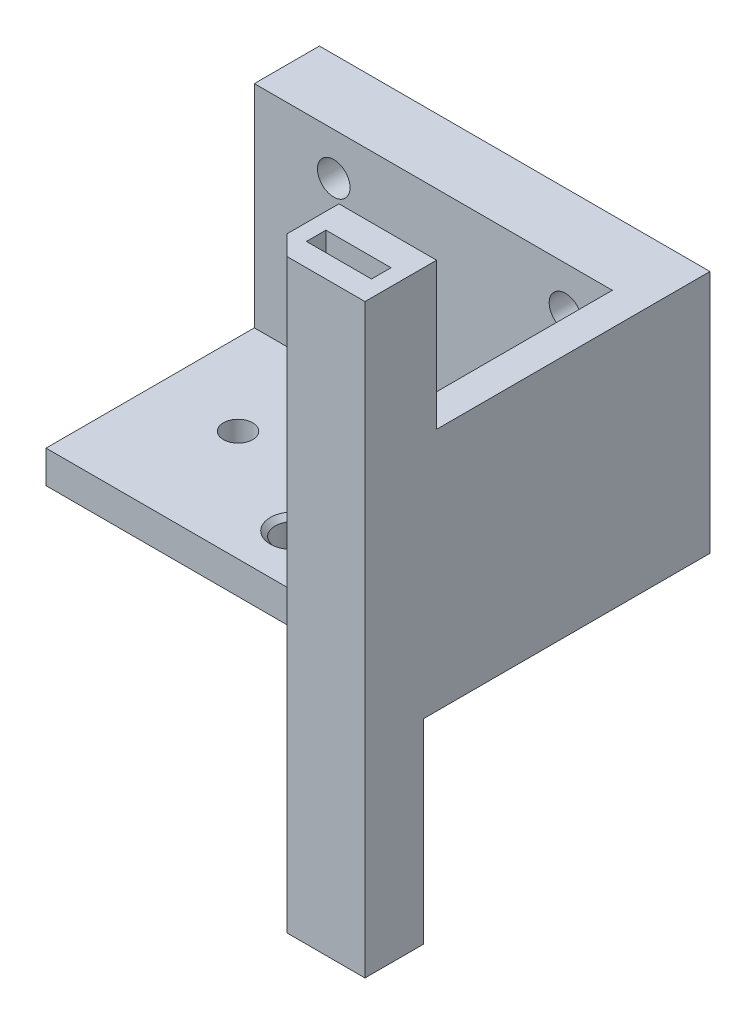
from build123d import *

# Parameters (mm, degrees)
SKETCH1_R                = 2.8
SKETCH1_R_2              = 2.25
BOSS_EXTRUDE1_DEPTH      = 5
SKETCH3_W                = 60
SKETCH3_H                = 10
BOSS_EXTRUDE3_DEPTH      = 32.5
SKETCH4_R                = 2.5
CUT_EXTRUDE1_DEPTH       = 64.798510954
CHAMFER1_SIZE            = 0.75
BOSS_EXTRUDE4_DEPTH      = 30
BOSS_EXTRUDE4_DEPTH_BACK = 60
SKETCH5_W                = 10
SKETCH5_H                = 3
CHAMFER2_SIZE            = 10
CHAMFER3_SIZE            = 5
SKETCH7_W                = 2
SKETCH7_H                = 30
CUT_EXTRUDE2_DEPTH       = 94.808315196
BOSS_EXTRUDE5_DEPTH      = 5


with BuildPart() as part:
    # Sketch1 → Boss-Extrude1 (new body)
    with BuildSketch(Plane(origin=(0, 0, 0), x_dir=(1, 0, 0), z_dir=(0, 1, 0))):
        Polygon((-30, 0), (-30, 40), (30, 40), (30, 0), (30, -2), (-30, -2), align=None)
        with Locations((-12.5, 22.5)):
            Circle(SKETCH1_R, mode=Mode.SUBTRACT)
        with Locations((12.5, 22.5)):
            Circle(SKETCH1_R, mode=Mode.SUBTRACT)
        with Locations((-17.5, 15)):
            Circle(SKETCH1_R_2, mode=Mode.SUBTRACT)
        with Locations((17.5, 15)):
            Circle(SKETCH1_R_2, mode=Mode.SUBTRACT)
        with Locations((0, 6)):
            Circle(SKETCH1_R, mode=Mode.SUBTRACT)
    extrude(amount=BOSS_EXTRUDE1_DEPTH)

    # Sketch3 → Boss-Extrude3 (add)
    with BuildSketch(Plane(origin=(0, 5, 0), x_dir=(1, 0, 0), z_dir=(0, 1, 0))):
        with Locations((0, 35)):
            Rectangle(SKETCH3_W, SKETCH3_H)
    extrude(amount=BOSS_EXTRUDE3_DEPTH)

    # Sketch4 → Cut-Extrude1 (cut, through all)
    with BuildSketch(Plane(origin=(0, 0, -40), x_dir=(-1, 0, 0), z_dir=(0, 0, -1))):
        with Locations((-17.8, 31)):
            Circle(SKETCH4_R)
        with Locations((17.8, 31)):
            Circle(SKETCH4_R)
    extrude(amount=-CUT_EXTRUDE1_DEPTH, mode=Mode.SUBTRACT)

    # Chamfer1
    chamfer1_edges = [part.edges().sort_by_distance(p)[0] for p in [
        (-15.3, 5, -22.5),
        (9.7, 5, -22.5),
        (-2.8, 5, -6),
    ]]
    chamfer(chamfer1_edges, length=CHAMFER1_SIZE)

    # Sketch5 → Boss-Extrude4 (add, two sides: drawn at the far end of the back side and taken through both)
    with BuildSketch(Plane.XZ.offset(-BOSS_EXTRUDE4_DEPTH_BACK)):
        Polygon((18, 13), (15, 10), (15, 2), (30, 2), (30, 13), align=None)
        with Locations((22.5, 8)):
            Rectangle(SKETCH5_W, SKETCH5_H, mode=Mode.SUBTRACT)
    extrude(amount=BOSS_EXTRUDE4_DEPTH + BOSS_EXTRUDE4_DEPTH_BACK)

    # Chamfer2
    chamfer2_edges = [part.edges().sort_by_distance(p)[0] for p in [
        (22.5, 5, 2),
    ]]
    chamfer(chamfer2_edges, length=CHAMFER2_SIZE)

    # Chamfer3
    chamfer3_edges = [part.edges().sort_by_distance(p)[0] for p in [
        (15, 5, -3),
        (15, 2.5, 2),
    ]]
    chamfer(chamfer3_edges, length=CHAMFER3_SIZE)

    # Sketch7 → Cut-Extrude2 (cut, through all)
    with BuildSketch(Plane(origin=(30, 0, 0), x_dir=(0, 0, -1), z_dir=(1, 0, 0))):
        with Locations((-3, -15)):
            Rectangle(SKETCH7_W, SKETCH7_H)
    extrude(amount=-CUT_EXTRUDE2_DEPTH, mode=Mode.SUBTRACT)

    # Sketch8 → Boss-Extrude5 (add)
    with BuildSketch(Plane(origin=(30, 0, 0), x_dir=(0, 0, -1), z_dir=(1, 0, 0))):
        Polygon((30, 37.5), (-2, 37.5), (-2, 15), (8, 5), (30, 5), align=None)
    extrude(amount=-BOSS_EXTRUDE5_DEPTH)


solid = part.part
